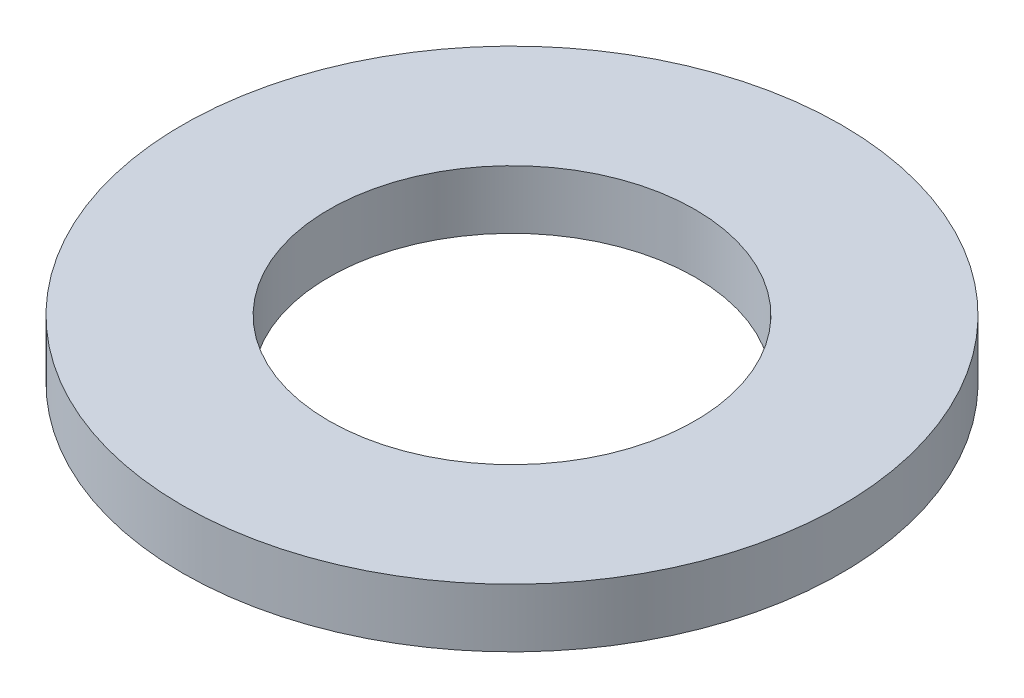
from build123d import *

# Parameters (mm, degrees)
SKETCH1_R           = 67.5
BOSS_EXTRUDE1_DEPTH = 12
SKETCH2_R           = 37.5
CUT_EXTRUDE1_DEPTH  = 97.210706265


with BuildPart() as part:
    # Sketch1 → Boss-Extrude1 (new body)
    with BuildSketch(Plane(origin=(0, 0, 0), x_dir=(1, 0, 0), z_dir=(0, 1, 0))):
        Circle(SKETCH1_R)
    extrude(amount=BOSS_EXTRUDE1_DEPTH)

    # Sketch2 → Cut-Extrude1 (cut, through all)
    with BuildSketch(Plane(origin=(0, 0, 0), x_dir=(1, 0, 0), z_dir=(0, 1, 0))):
        Circle(SKETCH2_R)
    extrude(amount=CUT_EXTRUDE1_DEPTH, mode=Mode.SUBTRACT)


solid = part.part
